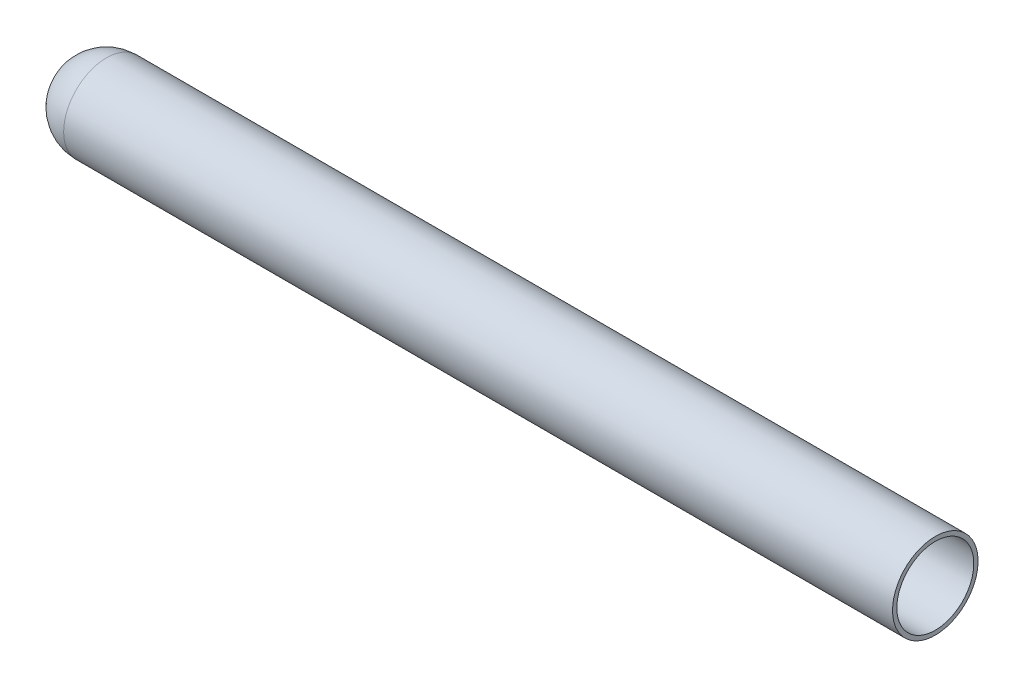
from build123d import *


with BuildPart() as part:
    # rootSketch → Revolve1 (revolve)
    with BuildSketch(Plane(origin=(0, 0, 0), x_dir=(1, 0, 0), z_dir=(0, 1, 0))):
        with BuildLine():
            Line((31.75, -31.75), (647, -31.75))
            Line((647, -31.75), (647, -28.575))
            Line((647, -28.575), (31.75, -28.575))
            ThreePointArc((31.75, -28.575), (11.544423728, -20.205576272), (3.175, 0))
            Line((3.175, 0), (0, 0))
            ThreePointArc((0, 0), (9.299359697, -22.450640303), (31.75, -31.75))
        make_face()
    revolve(axis=Axis((0, 0, 0), (1, 0, 0)))


solid = part.part
